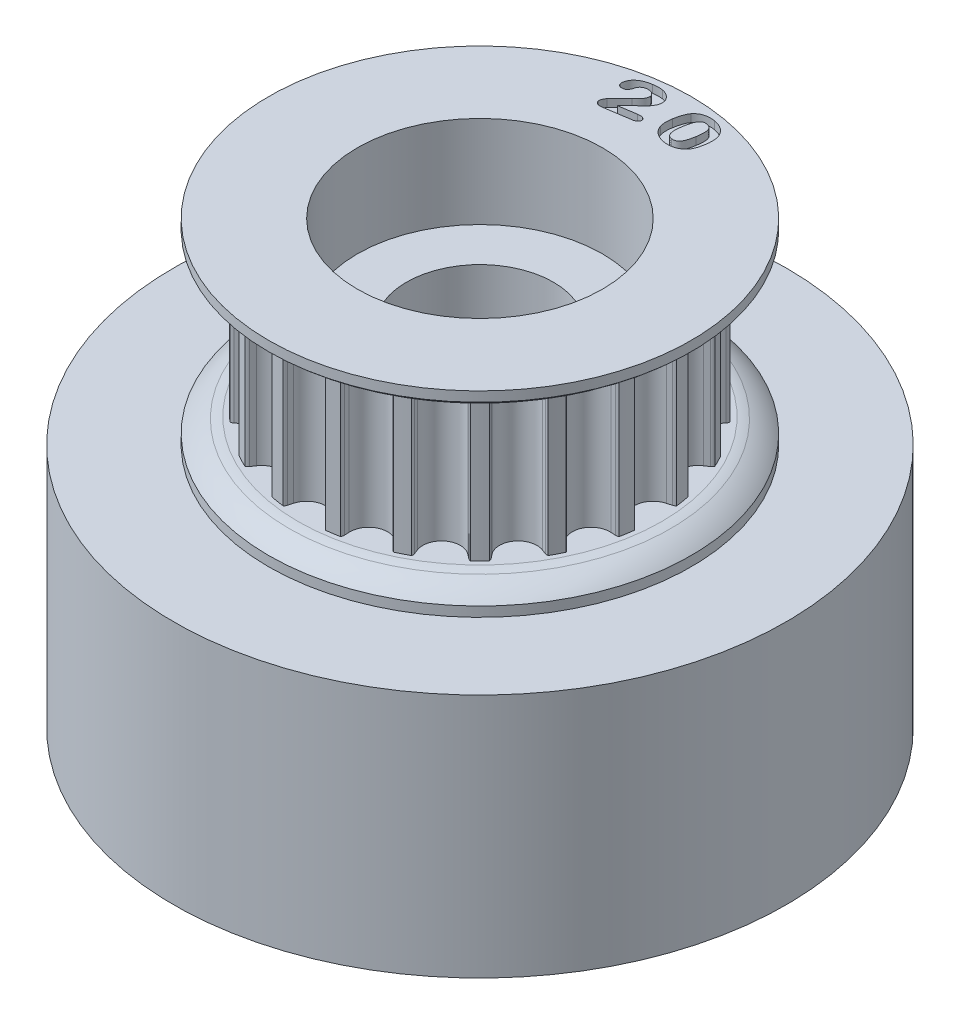
from build123d import *

# Parameters (mm, degrees)
SKETCH1_R                    = 9.168296891
TOOTHOD_DEPTH                = 3.81
TOOTHPROFILE_DEPTH           = 14.514119867
TOOTHPATTERN_COUNT           = 20
SMALL_TOOTH_COUNT_DEPTH      = 19.516706815
SMALL_TOOTH_COUNT_DEPTH_BACK = 0.4
SKETCH12_R                   = 15.875
BOSS_EXTRUDE1_DEPTH          = 12.7
SKETCH13_R                   = 3.81
CUT_EXTRUDE1_DEPTH           = 33.040768633
SKETCH14_R                   = 6.35
CUT_EXTRUDE2_DEPTH           = 4.7625
CUT_EXTRUDE3_START           = -4.7625
SKETCH15_R                   = 6.35
CUT_EXTRUDE3_DEPTH           = 4.7625


with BuildPart() as part:
    # Sketch1 → ToothOD (new, symmetric)
    with BuildSketch(Plane(origin=(0, 0, 0), x_dir=(1, 0, 0), z_dir=(0, 1, 0))):
        Circle(SKETCH1_R)
    extrude(amount=TOOTHOD_DEPTH, both=True)

    # Sketch2 → ToothProfile (cut, symmetric)
    with BuildSketch(Plane(origin=(0, 0, 0), x_dir=(1, 0, 0), z_dir=(0, 1, 0))):
        with BuildLine():
            ThreePointArc((-0.937033068, 8.718358887), (-0.590385173, 8.200184277), (0, 7.999896891))
            ThreePointArc((0, 7.999896891), (0.590385173, 8.200184277), (0.937033068, 8.718358887))
            ThreePointArc((0.937033068, 8.718358887), (0.971699064, 8.844470349), (1.007805813, 8.970176891))
            ThreePointArc((1.007805813, 8.970176891), (1.039709124, 9.042165511), (1.089260141, 9.10336093))
            ThreePointArc((1.089260141, 9.10336093), (0, 9.168296891), (-1.089260141, 9.10336093))
            ThreePointArc((-1.089260141, 9.10336093), (-1.039709124, 9.042165511), (-1.007805813, 8.970176891))
            ThreePointArc((-1.007805813, 8.970176891), (-0.971699064, 8.844470349), (-0.937033068, 8.718358887))
        make_face()
    toothprofile = extrude(amount=TOOTHPROFILE_DEPTH, both=True, mode=Mode.SUBTRACT)

    # ToothPattern: ToothProfile ×20 about axis
    toothpattern_axis = Axis((0, 3.81, 0), (0, -1, 0))
    for i in range(1, TOOTHPATTERN_COUNT):
        add(toothprofile.rotate(toothpattern_axis, i * 360 / TOOTHPATTERN_COUNT), mode=Mode.SUBTRACT)

    # Sketch4 → Flange (revolve)
    with BuildSketch(Plane.XY):
        with BuildLine():
            Line((0, -3.81), (9.422296891, -3.81))
            ThreePointArc((9.422296891, -3.81), (9.651943512, -3.845951298), (9.877369219, -3.902637424))
            ThreePointArc((9.877369219, -3.902637424), (10.445097796, -4.184197125), (10.946296891, -4.572))
            Line((10.946296891, -4.572), (10.946296891, -5.08))
            Line((10.946296891, -5.08), (0, -5.08))
            Line((0, -5.08), (0, -3.81))
        make_face()
        with BuildLine():
            Line((10.946296891, 5.08), (10.946296891, 4.572))
            ThreePointArc((10.946296891, 4.572), (10.445097796, 4.184197125), (9.877369219, 3.902637424))
            ThreePointArc((9.877369219, 3.902637424), (9.651943512, 3.845951298), (9.422296891, 3.81))
            Line((9.422296891, 3.81), (0, 3.81))
            Line((0, 3.81), (0, 5.08))
            Line((0, 5.08), (10.946296891, 5.08))
        make_face()
    revolve(axis=Axis((0, 8.73125, 0), (0, -1, 0)))

    # Sketch11 → Small Tooth Count (cut, two sides: drawn at the far end of the back side and taken through both)
    # profile 1 of 2: a face of its own
    with BuildSketch(Plane(origin=(0, 5.08, 0), x_dir=(1, 0, 0), z_dir=(0, 1, 0)).offset(-SMALL_TOOTH_COUNT_DEPTH_BACK)):
        with BuildLine():
            Line((-1.506669992, 8.621605484), (-0.594948898, 8.761801578))
            add(Edge.make_bspline(
                [(-0.594948898, 8.761801578), (-0.568508634, 8.765198423), (-0.51843609, 8.771631365), (-0.44654772, 8.772071074), (-0.382615431, 8.763265759), (-0.327096583, 8.746782768), (-0.28073736, 8.722976742), (-0.245229797, 8.692438756), (-0.219549143, 8.656177692), (-0.213233627, 8.628356784), (-0.210079367, 8.614461734)],
                knots=[0, 0, 0, 0, 1.405872796, 2.662440438, 3.780874982, 4.799416848, 5.705812893, 6.507413553, 7.254533237, 8, 8, 8, 8], degree=3))
            add(Edge.make_bspline(
                [(-0.210079367, 8.614461734), (-0.208889964, 8.601771408), (-0.206493047, 8.576197502), (-0.216741472, 8.537560395), (-0.235628299, 8.499855984), (-0.26391302, 8.463095811), (-0.302942444, 8.429662764), (-0.353193783, 8.402600281), (-0.413829448, 8.381641212), (-0.458320193, 8.373612775), (-0.481988351, 8.369341812)],
                knots=[0, 0, 0, 0, 0.747692017, 1.506770081, 2.320581731, 3.22962232, 4.226992794, 5.332726267, 6.581065457, 8, 8, 8, 8], degree=3))
            Line((-0.481988351, 8.369341812), (-1.850909445, 8.159494156))
            add(Edge.make_bspline(
                [(-1.850909445, 8.159494156), (-1.874677499, 8.156558384), (-1.920064022, 8.15095235), (-1.985993536, 8.153953423), (-2.045566646, 8.166819623), (-2.097937256, 8.188882133), (-2.141644576, 8.218958806), (-2.176056266, 8.25450227), (-2.200261447, 8.296079566), (-2.206948594, 8.326650658), (-2.210329367, 8.342106266)],
                knots=[0, 0, 0, 0, 1.280086864, 2.444402485, 3.513161164, 4.526674079, 5.465738593, 6.33344229, 7.157450346, 8, 8, 8, 8], degree=3))
            add(Edge.make_bspline(
                [(-2.210329367, 8.342106266), (-2.211321429, 8.35297506), (-2.213474856, 8.376567494), (-2.207871102, 8.414736071), (-2.197602748, 8.457816322), (-2.181066772, 8.504044131), (-2.161523691, 8.550563815), (-2.139011673, 8.59387946), (-2.114771053, 8.632517333), (-2.096113828, 8.655263986), (-2.087099679, 8.666253922)],
                knots=[0, 0, 0, 0, 0.73683643, 1.599419737, 2.594339727, 3.735396803, 4.918497864, 6.009402824, 7.038252518, 8, 8, 8, 8], degree=3))
            add(Edge.make_bspline(
                [(-2.087099679, 8.666253922), (-2.051926797, 8.70563464), (-1.983635312, 8.782096037), (-1.882781696, 8.891706347), (-1.787421488, 8.993402689), (-1.71040015, 9.071642309), (-1.653062288, 9.130098592), (-1.613191617, 9.168811361), (-1.576609875, 9.204115545), (-1.543103636, 9.235957396), (-1.512499045, 9.26401221), (-1.484693768, 9.288140763), (-1.460222689, 9.308797929), (-1.444641349, 9.320989249), (-1.437464914, 9.326604312)],
                knots=[0, 0, 0, 0, 2.05005439, 3.980374895, 5.783081705, 7.462550166, 8.242986023, 8.962167681, 9.620127169, 10.216906376, 10.75681469, 11.231916014, 11.646236775, 12, 12, 12, 12], degree=3))
            add(Edge.make_bspline(
                [(-1.437464914, 9.326604312), (-1.415699138, 9.344096052), (-1.373639167, 9.377896918), (-1.31556485, 9.430556423), (-1.263091792, 9.481497265), (-1.217417118, 9.532268382), (-1.177355276, 9.581870506), (-1.143339078, 9.630659742), (-1.115770383, 9.678955907), (-1.094008941, 9.726222335), (-1.079010073, 9.772608594), (-1.068990971, 9.817254636), (-1.066125276, 9.860516575), (-1.069031756, 9.888447706), (-1.070454757, 9.902122672)],
                knots=[0, 0, 0, 0, 1.412730359, 2.729946272, 3.965505171, 5.111982469, 6.183504339, 7.190458038, 8.118071664, 8.994433913, 9.818491729, 10.580687815, 11.305110666, 12, 12, 12, 12], degree=3))
            add(Edge.make_bspline(
                [(-1.070454757, 9.902122672), (-1.073101852, 9.915947961), (-1.078327528, 9.943240708), (-1.094494112, 9.981703166), (-1.116615509, 10.017043528), (-1.145060228, 10.04859137), (-1.178300901, 10.076950508), (-1.216302468, 10.101048218), (-1.258889714, 10.120303405), (-1.305215474, 10.134908931), (-1.354364351, 10.144457895), (-1.405333989, 10.149506523), (-1.457750016, 10.149178642), (-1.492860178, 10.144637273), (-1.510688351, 10.142331266)],
                knots=[0, 0, 0, 0, 0.907302037, 1.791120925, 2.676768316, 3.589403735, 4.523810352, 5.492033175, 6.485886253, 7.534944553, 8.622934081, 9.714528692, 10.839487572, 12, 12, 12, 12], degree=3))
            add(Edge.make_bspline(
                [(-1.510688351, 10.142331266), (-1.527596498, 10.139296406), (-1.560826651, 10.133331894), (-1.608260799, 10.117909964), (-1.652483903, 10.098012849), (-1.693864274, 10.074084955), (-1.731680005, 10.044484021), (-1.76651825, 10.010598615), (-1.798089169, 9.971893058), (-1.815934823, 9.943404547), (-1.825013351, 9.928911734)],
                knots=[0, 0, 0, 0, 1.046472807, 2.056668438, 3.031518194, 3.999586305, 4.963434377, 5.951707826, 6.95798289, 8, 8, 8, 8], degree=3))
            add(Edge.make_bspline(
                [(-1.825013351, 9.928911734), (-1.826559277, 9.925360904), (-1.831340104, 9.91437984), (-1.837656207, 9.890979564), (-1.847717966, 9.855611617), (-1.859566069, 9.81054411), (-1.873864818, 9.760908096), (-1.893574508, 9.713288417), (-1.916666393, 9.669565796), (-1.942422798, 9.628901741), (-1.976575179, 9.593383256), (-2.021136356, 9.565627073), (-2.075687033, 9.545210856), (-2.115811032, 9.537738725), (-2.137105929, 9.533773062)],
                knots=[0, 0, 0, 0, 0.255611913, 0.790488512, 1.596709105, 2.686601655, 3.868395343, 5.00580505, 6.083210694, 7.132990612, 8.175842434, 9.3076298, 10.571085967, 12, 12, 12, 12], degree=3))
            add(Edge.make_bspline(
                [(-2.137105929, 9.533773062), (-2.153754851, 9.531867902), (-2.186007077, 9.528177233), (-2.23368108, 9.532108784), (-2.278463536, 9.542658983), (-2.31955032, 9.560810626), (-2.355603746, 9.586270992), (-2.383667544, 9.619490715), (-2.403753934, 9.659477168), (-2.40984827, 9.688934956), (-2.413033273, 9.704330094)],
                knots=[0, 0, 0, 0, 1.103119517, 2.136958887, 3.137057405, 4.125913058, 5.082313969, 6.022605602, 6.966580255, 8, 8, 8, 8], degree=3))
            add(Edge.make_bspline(
                [(-2.413033273, 9.704330094), (-2.415009696, 9.722614032), (-2.419038371, 9.759883408), (-2.41588734, 9.817423499), (-2.405366179, 9.876857396), (-2.387446287, 9.937809803), (-2.362210558, 9.998975276), (-2.32919863, 10.0590732), (-2.288238244, 10.117088054), (-2.239926945, 10.173568432), (-2.18329972, 10.227352379), (-2.118289715, 10.277709516), (-2.044964572, 10.324806196), (-1.963139928, 10.367987482), (-1.872740102, 10.406840276), (-1.773817701, 10.440289158), (-1.666292684, 10.467537519), (-1.591307924, 10.480391675), (-1.552657882, 10.487017203)],
                knots=[0, 0, 0, 0, 0.686274673, 1.398879655, 2.144007501, 2.9376906, 3.768012583, 4.611728168, 5.494195759, 6.417073659, 7.384708564, 8.407017315, 9.485272479, 10.637082362, 11.860187496, 13.158039043, 14.535143527, 16, 16, 16, 16], degree=3))
            add(Edge.make_bspline(
                [(-1.552657882, 10.487017203), (-1.52841577, 10.490420955), (-1.480751914, 10.497113273), (-1.410338577, 10.504749177), (-1.342432419, 10.509701208), (-1.277046262, 10.51204123), (-1.214045238, 10.511479586), (-1.153411338, 10.508973664), (-1.095114995, 10.503782012), (-1.05733219, 10.497930911), (-1.038754367, 10.495053922)],
                knots=[0, 0, 0, 0, 1.138402681, 2.238281105, 3.293071229, 4.304174642, 5.280103653, 6.222317189, 7.125912474, 8, 8, 8, 8], degree=3))
            add(Edge.make_bspline(
                [(-1.038754367, 10.495053922), (-1.012752892, 10.489369266), (-0.96200432, 10.478274198), (-0.888985545, 10.45489373), (-0.821106831, 10.425791147), (-0.75796727, 10.391965838), (-0.700394534, 10.353338936), (-0.647860502, 10.311763872), (-0.60189878, 10.265513926), (-0.561703519, 10.21630272), (-0.52825955, 10.16388857), (-0.500935533, 10.109658948), (-0.481526714, 10.052937679), (-0.474093975, 10.014001671), (-0.470379757, 9.994544937)],
                knots=[0, 0, 0, 0, 1.187267261, 2.317257711, 3.41519456, 4.479015239, 5.508703171, 6.505479901, 7.463513324, 8.412595886, 9.335595681, 10.232590248, 11.116806744, 12, 12, 12, 12], degree=3))
            add(Edge.make_bspline(
                [(-0.470379757, 9.994544937), (-0.468313859, 9.979241775), (-0.464214985, 9.948879331), (-0.463028656, 9.902976173), (-0.465763305, 9.85759698), (-0.472017419, 9.812321869), (-0.482311465, 9.767549639), (-0.496288954, 9.722898988), (-0.514091815, 9.678640488), (-0.543276505, 9.621627388), (-0.5821308, 9.554514276), (-0.631232404, 9.480877647), (-0.681592679, 9.416301746), (-0.726197052, 9.368271741), (-0.764793863, 9.33139352), (-0.797639899, 9.300077015), (-0.835761225, 9.26560612), (-0.877842806, 9.226250562), (-0.924928843, 9.183462306), (-0.976268817, 9.136246595), (-1.032855305, 9.085860231), (-1.092257956, 9.032453687), (-1.15175781, 8.978868961), (-1.207750431, 8.927106786), (-1.258421687, 8.87803841), (-1.304564576, 8.832351062), (-1.346165344, 8.790274212), (-1.382469769, 8.750659594), (-1.414153642, 8.714540455), (-1.432796387, 8.690739083), (-1.441483273, 8.679648453)],
                knots=[0, 0, 0, 0, 0.765164555, 1.518135043, 2.272081093, 3.017164573, 3.78151037, 4.54699507, 5.334877641, 6.143361033, 7.720335075, 9.177470953, 10.528127201, 11.776029629, 12.423102498, 13.17473405, 14.025995043, 14.971095859, 16.031319452, 17.180387881, 18.429249831, 19.78780431, 21.140877121, 22.399207521, 23.568147666, 24.637778838, 25.618752723, 26.501291816, 27.301652942, 28, 28, 28, 28], degree=3))
            add(Edge.make_bspline(
                [(-1.441483273, 8.679648453), (-1.451024119, 8.669362064), (-1.470895109, 8.64793831), (-1.494433375, 8.630612493), (-1.506669992, 8.621605484)],
                knots=[0, 0, 0, 0, 0.960278846, 2, 2, 2, 2], degree=3))
        make_face()
    # profile 2 of 2: a face of its own
    with BuildSketch(Plane(origin=(0, 5.08, 0), x_dir=(1, 0, 0), z_dir=(0, 1, 0)).offset(-SMALL_TOOTH_COUNT_DEPTH_BACK)):
        with BuildLine():
            add(Edge.make_bspline(
                [(2.521229896, 9.153250714), (2.514467417, 9.114331133), (2.501375208, 9.038982547), (2.476189731, 8.931019637), (2.448391477, 8.831414752), (2.41627952, 8.739886904), (2.378580312, 8.655208303), (2.333662702, 8.576282065), (2.28056349, 8.502806584), (2.239517066, 8.458424488), (2.218959975, 8.436196808)],
                knots=[0, 0, 0, 0, 1.197816622, 2.318981513, 3.360576657, 4.332771104, 5.258067283, 6.167820488, 7.08239799, 8, 8, 8, 8], degree=3))
            add(Edge.make_bspline(
                [(2.218959975, 8.436196808), (2.205275009, 8.423663594), (2.177907279, 8.398599184), (2.134059716, 8.364260437), (2.088071109, 8.333006575), (2.039785643, 8.304743143), (1.989550721, 8.278773676), (1.936835937, 8.256101806), (1.881942891, 8.236359545), (1.825149112, 8.219500514), (1.766697624, 8.205754783), (1.707126468, 8.194825908), (1.646407165, 8.187880235), (1.584719948, 8.183867918), (1.522118327, 8.182834396), (1.458502199, 8.185766137), (1.393816539, 8.191382855), (1.350521734, 8.197707426), (1.328670131, 8.200899542)],
                knots=[0, 0, 0, 0, 0.93291548, 1.865680846, 2.797725327, 3.727031371, 4.677641216, 5.639730716, 6.610369715, 7.609670098, 8.617176476, 9.628650139, 10.653519567, 11.688531753, 12.736425111, 13.800128213, 14.889688351, 16, 16, 16, 16], degree=3))
            add(Edge.make_bspline(
                [(1.328670131, 8.200899542), (1.304646394, 8.205220484), (1.257203503, 8.213753627), (1.18781296, 8.23151701), (1.120790602, 8.252044298), (1.056736848, 8.277712383), (0.994560804, 8.305228126), (0.935484496, 8.337874379), (0.878674814, 8.373435544), (0.82477308, 8.412787726), (0.773903306, 8.45482211), (0.727353595, 8.500348975), (0.684394665, 8.547850788), (0.645899136, 8.598367841), (0.610747043, 8.650879666), (0.580745341, 8.706643126), (0.55329609, 8.764159435), (0.539221084, 8.804399381), (0.532142006, 8.824638214)],
                knots=[0, 0, 0, 0, 1.10007563, 2.172466751, 3.227143423, 4.257552548, 5.281497242, 6.290338483, 7.297415566, 8.30126899, 9.296927188, 10.269623161, 11.234139214, 12.181584922, 13.130644758, 14.07951484, 15.034084745, 16, 16, 16, 16], degree=3))
            add(Edge.make_bspline(
                [(0.532142006, 8.824638214), (0.52615837, 8.847782329), (0.514084697, 8.894482113), (0.501813118, 8.966894827), (0.493775928, 9.0417501), (0.490445423, 9.119426362), (0.490666538, 9.199618449), (0.496210115, 9.282231021), (0.503606806, 9.367250372), (0.512463155, 9.424307392), (0.516961537, 9.453288214)],
                knots=[0, 0, 0, 0, 0.905014982, 1.826123087, 2.778485302, 3.754652627, 4.7692495, 5.813855209, 6.889597225, 8, 8, 8, 8], degree=3))
            add(Edge.make_bspline(
                [(0.516961537, 9.453288214), (0.523325905, 9.490560127), (0.535720579, 9.563147568), (0.55933727, 9.668003979), (0.5844305, 9.766634551), (0.612970482, 9.858600712), (0.64439816, 9.944227808), (0.679880246, 10.022828922), (0.717715358, 10.095512039), (0.747525153, 10.139490833), (0.762081459, 10.160965948)],
                knots=[0, 0, 0, 0, 1.201681521, 2.340287322, 3.415405821, 4.435878157, 5.399850355, 6.312483121, 7.175975126, 8, 8, 8, 8], degree=3))
            add(Edge.make_bspline(
                [(0.762081459, 10.160965948), (0.774828842, 10.17676135), (0.800074019, 10.208042886), (0.841220909, 10.251713634), (0.88587565, 10.290871371), (0.932387944, 10.32738338), (0.982580054, 10.358897904), (1.034664639, 10.38777536), (1.089902104, 10.412231106), (1.147510795, 10.433156292), (1.207417656, 10.450689851), (1.269507627, 10.4639749), (1.333637638, 10.473425968), (1.399716674, 10.478545461), (1.467681543, 10.480470445), (1.537440063, 10.478088032), (1.609149993, 10.471939414), (1.657315891, 10.464692945), (1.681839271, 10.461003448)],
                knots=[0, 0, 0, 0, 0.955906321, 1.893096325, 2.821646992, 3.751281967, 4.674977399, 5.609857368, 6.554385909, 7.516850138, 8.495190457, 9.492041425, 10.505248328, 11.546159141, 12.612074782, 13.706223803, 14.832137504, 16, 16, 16, 16], degree=3))
            add(Edge.make_bspline(
                [(1.681839271, 10.461003448), (1.715125841, 10.454918869), (1.780419666, 10.44298356), (1.874854016, 10.417537047), (1.963485178, 10.385567036), (2.046913834, 10.348792234), (2.124090678, 10.305722921), (2.195756531, 10.258175816), (2.260135605, 10.204002477), (2.318717967, 10.145730408), (2.370411791, 10.083130343), (2.41571801, 10.017521439), (2.455162972, 9.949402488), (2.475431239, 9.901347363), (2.485511146, 9.87744837)],
                knots=[0, 0, 0, 0, 1.169848554, 2.29473594, 3.377324729, 4.42560394, 5.443889475, 6.430264097, 7.394998098, 8.34849156, 9.284234536, 10.197935034, 11.10378884, 12, 12, 12, 12], degree=3))
            add(Edge.make_bspline(
                [(2.485511146, 9.87744837), (2.493967445, 9.853317928), (2.511238818, 9.80403326), (2.529677645, 9.725965745), (2.542427005, 9.642951838), (2.550190584, 9.554802313), (2.55100705, 9.461430846), (2.547053769, 9.363063146), (2.537081025, 9.259657525), (2.526610992, 9.189373392), (2.521229896, 9.153250714)],
                knots=[0, 0, 0, 0, 0.836436938, 1.708361459, 2.620531389, 3.583716828, 4.601894713, 5.674446874, 6.804777066, 8, 8, 8, 8], degree=3))
        make_face()
        with BuildLine():
            add(Edge.make_bspline(
                [(1.926066225, 9.280945245), (1.929639112, 9.302652318), (1.936624175, 9.345090069), (1.944348896, 9.407698134), (1.951189365, 9.467351767), (1.95632279, 9.524057379), (1.958749727, 9.577837607), (1.96031339, 9.628596383), (1.959891971, 9.67656084), (1.956997671, 9.73519055), (1.949781255, 9.802759589), (1.931427395, 9.876157184), (1.905925807, 9.940355502), (1.876483584, 9.986271687), (1.848721645, 10.017500659), (1.825924501, 10.038980767), (1.799622889, 10.056929439), (1.771474471, 10.073745284), (1.740457053, 10.087978321), (1.706958978, 10.099902039), (1.670876317, 10.109956253), (1.64572008, 10.114445262), (1.63272599, 10.116763995)],
                knots=[0, 0, 0, 0, 1.312369398, 2.565707771, 3.762969096, 4.894865689, 5.961716046, 6.974309811, 7.924439335, 8.822349658, 10.476599572, 11.96901351, 13.322783385, 14.581332123, 15.19779026, 15.813608585, 16.444290904, 17.09302893, 17.768383358, 18.476172141, 19.212888818, 20, 20, 20, 20], degree=3))
            add(Edge.make_bspline(
                [(1.63272599, 10.116763995), (1.616236884, 10.118791126), (1.584223189, 10.122726811), (1.536850377, 10.122031778), (1.492163618, 10.114358637), (1.450126478, 10.10041878), (1.410628532, 10.079968283), (1.374060817, 10.052985161), (1.340058724, 10.019712333), (1.308799547, 9.979978713), (1.279506458, 9.933281946), (1.25264394, 9.879124197), (1.227260674, 9.817576156), (1.203249669, 9.748530545), (1.180513955, 9.672008881), (1.160256741, 9.587553202), (1.141078941, 9.49582589), (1.129942032, 9.431893115), (1.124180287, 9.39881712)],
                knots=[0, 0, 0, 0, 0.807721886, 1.568196673, 2.295578314, 3.005447698, 3.714725893, 4.450493646, 5.208378312, 6.022630615, 6.904584524, 7.885827912, 8.960326096, 10.142057135, 11.441159905, 12.842684226, 14.36654425, 16, 16, 16, 16], degree=3))
            add(Edge.make_bspline(
                [(1.124180287, 9.39881712), (1.120455613, 9.375919272), (1.113188749, 9.331245425), (1.105107851, 9.265507398), (1.09745129, 9.202921023), (1.092994439, 9.143308124), (1.088895013, 9.086778131), (1.087951591, 9.033450735), (1.087522018, 8.983114871), (1.089882058, 8.935893425), (1.093832045, 8.891495709), (1.099523827, 8.850044706), (1.107190271, 8.81130052), (1.116373914, 8.775302538), (1.127500444, 8.742141755), (1.140520259, 8.71175164), (1.155630286, 8.684343501), (1.177565393, 8.651244075), (1.211377266, 8.615828061), (1.260298817, 8.582412036), (1.316979046, 8.557108986), (1.358494959, 8.548931518), (1.380015834, 8.544692511)],
                knots=[0, 0, 0, 0, 1.391773001, 2.715357887, 3.973653415, 5.174257869, 6.301665395, 7.373563966, 8.373690141, 9.321290573, 10.208976216, 11.047512421, 11.830326642, 12.577545501, 13.275034374, 13.926963487, 14.558388487, 15.150313643, 16.306252615, 17.467971661, 18.687455893, 20, 20, 20, 20], degree=3))
            add(Edge.make_bspline(
                [(1.380015834, 8.544692511), (1.393090761, 8.542842907), (1.418416693, 8.539260252), (1.455907601, 8.537514391), (1.491633047, 8.538695969), (1.525649661, 8.543336546), (1.558144512, 8.550121925), (1.588479985, 8.561203154), (1.617515887, 8.574391151), (1.653572515, 8.597719918), (1.696033519, 8.634319017), (1.741297628, 8.689222442), (1.781408029, 8.755697455), (1.809907752, 8.819083792), (1.830654828, 8.875577778), (1.846331082, 8.922618534), (1.861458069, 8.973369263), (1.875756212, 9.027870376), (1.888843222, 9.086066658), (1.902491288, 9.147571428), (1.914985474, 9.212934077), (1.922304793, 9.257858417), (1.926066225, 9.280945245)],
                knots=[0, 0, 0, 0, 0.763857224, 1.47957972, 2.169117335, 2.829360205, 3.464635954, 4.0857402, 4.694539356, 5.306256096, 6.564662962, 7.92221381, 9.406804878, 11.04489232, 11.9360533, 12.889356106, 13.913997122, 15.000349245, 16.149488943, 17.365868071, 18.646307277, 20, 20, 20, 20], degree=3))
        make_face(mode=Mode.SUBTRACT)
    extrude(amount=SMALL_TOOTH_COUNT_DEPTH + SMALL_TOOTH_COUNT_DEPTH_BACK, mode=Mode.SUBTRACT)

    # Sketch12 → Boss-Extrude1 (add)
    with BuildSketch(Plane.XZ.offset(5.08)):
        Circle(SKETCH12_R)
    extrude(amount=BOSS_EXTRUDE1_DEPTH)

    # Sketch13 → Cut-Extrude1 (cut, through all)
    with BuildSketch(Plane.XZ.offset(17.78)):
        Circle(SKETCH13_R)
    extrude(amount=-CUT_EXTRUDE1_DEPTH, mode=Mode.SUBTRACT)

    # Sketch14 → Cut-Extrude2 (cut)
    with BuildSketch(Plane.XZ.offset(17.78)):
        Circle(SKETCH14_R)
    extrude(amount=-CUT_EXTRUDE2_DEPTH, mode=Mode.SUBTRACT)

    # Sketch15 → Cut-Extrude3 (cut)
    with BuildSketch(Plane(origin=(0, 5.08, 0), x_dir=(1, 0, 0), z_dir=(0, 1, 0)).offset(CUT_EXTRUDE3_START)):
        Circle(SKETCH15_R)
    extrude(amount=CUT_EXTRUDE3_DEPTH, mode=Mode.SUBTRACT)


solid = part.part
